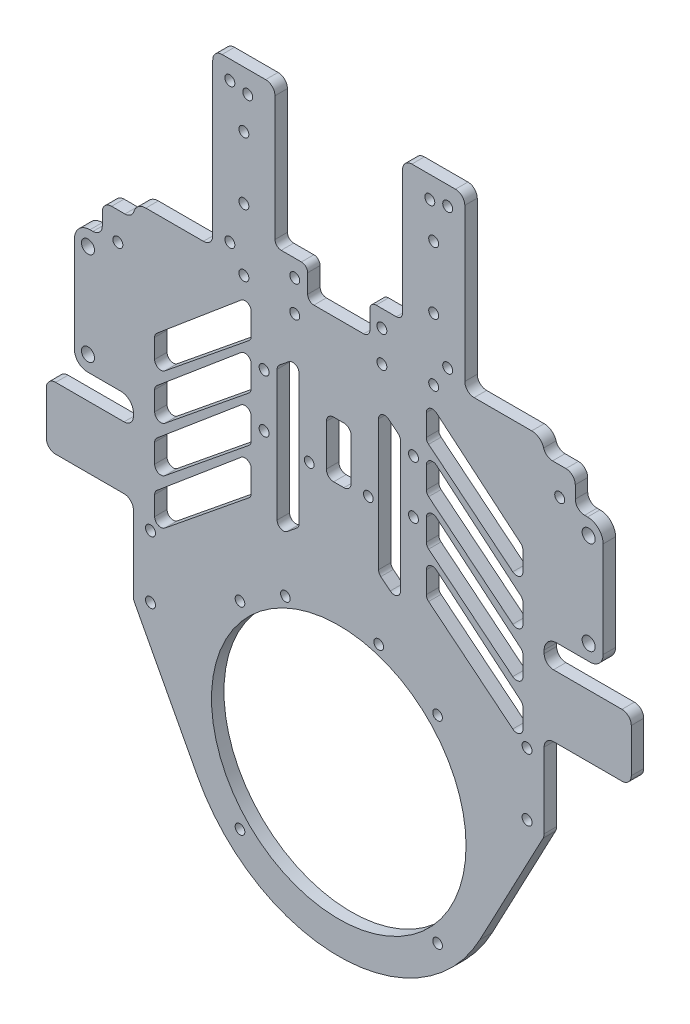
from build123d import *

# Parameters (mm, degrees)
SKETCH_1_R           = 40.9
SKETCH_1_R_2         = 1.55
SKETCH_1_R_3         = 1.6
EXTRUDE_1_DEPTH      = 4
SKETCH_2_R           = 2.1
EXTRUDE_2_DEPTH      = 4
CUT_EXTRUDE_1_DEPTH  = 4
FILLET_1_R           = 4
SKETCH_4_W           = 20
SKETCH_4_H           = 7
CUT_EXTRUDE_2_DEPTH  = 153.014810134
FILLET_2_R           = 2
SKETCH_5_W           = 20
SKETCH_5_H           = 55
EXTRUDE_3_DEPTH      = 4
FILLET_3_R           = 3
SKETCH_7_R           = 1.6
CUT_EXTRUDE_4_DEPTH  = 10
SKETCH_8_R           = 1.6
CUT_EXTRUDE_7_DEPTH  = 24
SKETCH_9_W           = 10
SKETCH_9_H           = 10
EXTRUDE_4_DEPTH      = 4
FILLET_5_R           = 3
SKETCH_10_R          = 1.6
CUT_EXTRUDE_6_DEPTH  = 4
SKETCH_11_W          = 28
SKETCH_11_H          = 20
EXTRUDE_5_DEPTH      = 4
FILLET_6_R           = 3
SKETCH_13_R          = 1.6
CUT_EXTRUDE_8_DEPTH  = 45
SKETCH_14_R          = 1.6
CUT_EXTRUDE_9_DEPTH  = 10
SKETCH_15_R          = 1.6
CUT_EXTRUDE_10_DEPTH = 10
EXTRUDE_START        = -4
SKETCH_16_R          = 1.6
EXTRUDE_6_DEPTH      = 4
SKETCH_17_W          = 20
SKETCH_17_H          = 10
CUT_EXTRUDE_11_DEPTH = 4
FILLET_7_R           = 2


with BuildPart() as part:
    # 草图1 → 凸台-拉伸1 (new body)
    with BuildSketch(Plane.XY):
        with BuildLine():
            Line((-66, 126), (66, 126))
            Line((66, 126), (66, 15.1))
            Line((66, 15.1), (45.315301009, -23.983091524))
            ThreePointArc((45.315301009, -23.983091524), (0, -51.270509892), (-45.315301009, -23.983091524))
            Line((-45.315301009, -23.983091524), (-66, 15.1))
            Line((-66, 15.1), (-66, 126))
        make_face()
        Circle(SKETCH_1_R, mode=Mode.SUBTRACT)
        with Locations((-31.749094475, 31.749094475)):
            Circle(SKETCH_1_R_2, mode=Mode.SUBTRACT)
        with Locations((-17.153096541, 40.410163067)):
            Circle(SKETCH_1_R_2, mode=Mode.SUBTRACT)
        with Locations((12.835117837, 41.981778787)):
            Circle(SKETCH_1_R_2, mode=Mode.SUBTRACT)
        with Locations((31.749094475, 31.749094475)):
            Circle(SKETCH_1_R_2, mode=Mode.SUBTRACT)
        with Locations((31.749094475, -31.749094475)):
            Circle(SKETCH_1_R_2, mode=Mode.SUBTRACT)
        with Locations((-31.749094475, -31.749094475)):
            Circle(SKETCH_1_R_2, mode=Mode.SUBTRACT)
        with Locations((-9.5, 81.5)):
            Circle(SKETCH_1_R_2, mode=Mode.SUBTRACT)
        with Locations((9.5, 81.5)):
            Circle(SKETCH_1_R_2, mode=Mode.SUBTRACT)
        with Locations((-14.15, 120.5)):
            Circle(SKETCH_1_R_3, mode=Mode.SUBTRACT)
        with Locations((13.85, 120.5)):
            Circle(SKETCH_1_R_3, mode=Mode.SUBTRACT)
    extrude(amount=EXTRUDE_1_DEPTH)

    # 草图2 → 凸台-拉伸2 (add)
    # profile 1 of 2: a face of its own
    with BuildSketch(Plane.XY.offset(4)):
        with BuildLine():
            Line((-66, 111), (-79.95, 111))
            ThreePointArc((-79.95, 111), (-83.485533906, 109.535533906), (-84.95, 106))
            Line((-84.95, 106), (-84.95, 75.2))
            ThreePointArc((-84.95, 75.2), (-83.719848481, 72.230151519), (-80.75, 71))
            Line((-80.75, 71), (-66, 71))
            Line((-66, 71), (-66, 111))
        make_face()
        with Locations((-80.6, 106)):
            Circle(SKETCH_2_R, mode=Mode.SUBTRACT)
        with Locations((-80.6, 76)):
            Circle(SKETCH_2_R, mode=Mode.SUBTRACT)
    # profile 2 of 2: a face of its own
    with BuildSketch(Plane.XY.offset(4)):
        with BuildLine():
            Line((66, 71), (66, 111))
            Line((66, 111), (79.95, 111))
            ThreePointArc((79.95, 111), (83.485533906, 109.535533906), (84.95, 106))
            Line((84.95, 106), (84.95, 75.2))
            ThreePointArc((84.95, 75.2), (83.719848481, 72.230151519), (80.75, 71))
            Line((80.75, 71), (66, 71))
        make_face()
        with Locations((80.3, 76)):
            Circle(SKETCH_2_R, mode=Mode.SUBTRACT)
        with Locations((80.3, 106)):
            Circle(SKETCH_2_R, mode=Mode.SUBTRACT)
    extrude(amount=-EXTRUDE_2_DEPTH)

    # 草图3 → 切除-拉伸1 (cut)
    with BuildSketch(Plane.XY.offset(4)):
        with BuildLine():
            Line((-4, 95.643321095), (-4, 82.356678905))
            ThreePointArc((-4, 82.356678905), (-3.30974473, 80.69025527), (-1.643321095, 80))
            Line((-1.643321095, 80), (1.643321095, 80))
            ThreePointArc((1.643321095, 80), (3.30974473, 80.69025527), (4, 82.356678905))
            Line((4, 82.356678905), (4, 95.643321095))
            ThreePointArc((4, 95.643321095), (3.30974473, 97.30974473), (1.643321095, 98))
            Line((1.643321095, 98), (-1.643321095, 98))
            ThreePointArc((-1.643321095, 98), (-3.30974473, 97.30974473), (-4, 95.643321095))
        make_face()
        with BuildLine():
            Line((-31.418930635, 115.671893756), (-58.46194948, 92.944156195))
            ThreePointArc((-58.46194948, 92.944156195), (-58.988125143, 92.257599911), (-59.175180233, 91.41307001))
            Line((-59.175180233, 91.41307001), (-59.175180233, 85.281378001))
            ThreePointArc((-59.175180233, 85.281378001), (-58.035180005, 83.475720117), (-55.914779841, 83.728512633))
            Line((-55.914779841, 83.728512633), (-28.871760995, 105.67827871))
            ThreePointArc((-28.871760995, 105.67827871), (-28.326503504, 106.371144306), (-28.132161388, 107.231144078))
            Line((-28.132161388, 107.231144078), (-28.132161388, 114.140807571))
            ThreePointArc((-28.132161388, 114.140807571), (-29.287631487, 115.953752481), (-31.418930635, 115.671893756))
        make_face()
        with BuildLine():
            Line((-28.132161388, 92.648467718), (-28.132161388, 99.558131211))
            ThreePointArc((-28.132161388, 99.558131211), (-29.287631487, 101.371076121), (-31.418930635, 101.089217396))
            Line((-31.418930635, 101.089217396), (-58.46194948, 78.361479835))
            ThreePointArc((-58.46194948, 78.361479835), (-58.988125143, 77.674923551), (-59.175180233, 76.83039365))
            Line((-59.175180233, 76.83039365), (-59.175180233, 70.698701641))
            ThreePointArc((-59.175180233, 70.698701641), (-58.035180005, 68.893043757), (-55.914779841, 69.145836273))
            Line((-55.914779841, 69.145836273), (-28.871760995, 91.09560235))
            ThreePointArc((-28.871760995, 91.09560235), (-28.326503504, 91.788467946), (-28.132161388, 92.648467718))
        make_face()
        with BuildLine():
            Line((-28.132161388, 78.065791358), (-28.132161388, 84.975454851))
            ThreePointArc((-28.132161388, 84.975454851), (-29.287631487, 86.788399761), (-31.418930635, 86.506541036))
            Line((-31.418930635, 86.506541036), (-58.46194948, 63.778803475))
            ThreePointArc((-58.46194948, 63.778803475), (-58.988125143, 63.092247191), (-59.175180233, 62.24771729))
            Line((-59.175180233, 62.24771729), (-59.175180233, 56.116025281))
            ThreePointArc((-59.175180233, 56.116025281), (-58.035180005, 54.310367397), (-55.914779841, 54.563159913))
            Line((-55.914779841, 54.563159913), (-28.871760995, 76.51292599))
            ThreePointArc((-28.871760995, 76.51292599), (-28.326503504, 77.205791586), (-28.132161388, 78.065791358))
        make_face()
        with BuildLine():
            Line((-28.132161388, 63.483114998), (-28.132161388, 70.392778491))
            ThreePointArc((-28.132161388, 70.392778491), (-29.287631487, 72.205723401), (-31.418930635, 71.923864676))
            Line((-31.418930635, 71.923864676), (-58.46194948, 49.196127115))
            ThreePointArc((-58.46194948, 49.196127115), (-58.988125143, 48.509570831), (-59.175180233, 47.66504093))
            Line((-59.175180233, 47.66504093), (-59.175180233, 41.533348921))
            ThreePointArc((-59.175180233, 41.533348921), (-58.035180005, 39.727691037), (-55.914779841, 39.980483553))
            Line((-55.914779841, 39.980483553), (-28.871760995, 61.93024963))
            ThreePointArc((-28.871760995, 61.93024963), (-28.326503504, 62.623115226), (-28.132161388, 63.483114998))
        make_face()
        with BuildLine():
            Line((-16.032131174, 106.246310649), (-19.07458677, 103.776867832))
            ThreePointArc((-19.07458677, 103.776867832), (-19.619844261, 103.084002236), (-19.814186377, 102.224002464))
            Line((-19.814186377, 102.224002464), (-19.814186377, 60.267683622))
            ThreePointArc((-19.814186377, 60.267683622), (-18.674186149, 58.462025739), (-16.553785984, 58.714818255))
            Line((-16.553785984, 58.714818255), (-13.511330388, 61.184261072))
            ThreePointArc((-13.511330388, 61.184261072), (-12.966072897, 61.877126668), (-12.771730781, 62.737126439))
            Line((-12.771730781, 62.737126439), (-12.771730781, 104.693445281))
            ThreePointArc((-12.771730781, 104.693445281), (-13.911731009, 106.499103165), (-16.032131174, 106.246310649))
        make_face()
        with BuildLine():
            Line((12.771730781, 62.737126439), (12.771730781, 104.693445281))
            ThreePointArc((12.771730781, 104.693445281), (13.911731009, 106.499103165), (16.032131174, 106.246310649))
            Line((16.032131174, 106.246310649), (19.07458677, 103.776867832))
            ThreePointArc((19.07458677, 103.776867832), (19.619844261, 103.084002236), (19.814186377, 102.224002464))
            Line((19.814186377, 102.224002464), (19.814186377, 60.267683622))
            ThreePointArc((19.814186377, 60.267683622), (18.674186149, 58.462025739), (16.553785984, 58.714818255))
            Line((16.553785984, 58.714818255), (13.511330388, 61.184261072))
            ThreePointArc((13.511330388, 61.184261072), (12.966072897, 61.877126668), (12.771730781, 62.737126439))
        make_face()
        with BuildLine():
            Line((59.175180233, 47.66504093), (59.175180233, 41.533348921))
            ThreePointArc((59.175180233, 41.533348921), (58.035180005, 39.727691037), (55.914779841, 39.980483553))
            Line((55.914779841, 39.980483553), (28.871760995, 61.93024963))
            ThreePointArc((28.871760995, 61.93024963), (28.326503504, 62.623115226), (28.132161388, 63.483114998))
            Line((28.132161388, 63.483114998), (28.132161388, 70.392778491))
            ThreePointArc((28.132161388, 70.392778491), (29.287631487, 72.205723401), (31.418930635, 71.923864676))
            Line((31.418930635, 71.923864676), (58.46194948, 49.196127115))
            ThreePointArc((58.46194948, 49.196127115), (58.988125143, 48.509570831), (59.175180233, 47.66504093))
        make_face()
        with BuildLine():
            Line((59.175180233, 62.24771729), (59.175180233, 56.116025281))
            ThreePointArc((59.175180233, 56.116025281), (58.035180005, 54.310367397), (55.914779841, 54.563159913))
            Line((55.914779841, 54.563159913), (28.871760995, 76.51292599))
            ThreePointArc((28.871760995, 76.51292599), (28.326503504, 77.205791586), (28.132161388, 78.065791358))
            Line((28.132161388, 78.065791358), (28.132161388, 84.975454851))
            ThreePointArc((28.132161388, 84.975454851), (29.287631487, 86.788399761), (31.418930635, 86.506541036))
            Line((31.418930635, 86.506541036), (58.46194948, 63.778803475))
            ThreePointArc((58.46194948, 63.778803475), (58.988125143, 63.092247191), (59.175180233, 62.24771729))
        make_face()
        with BuildLine():
            Line((59.175180233, 76.83039365), (59.175180233, 70.698701641))
            ThreePointArc((59.175180233, 70.698701641), (58.035180005, 68.893043757), (55.914779841, 69.145836273))
            Line((55.914779841, 69.145836273), (28.871760995, 91.09560235))
            ThreePointArc((28.871760995, 91.09560235), (28.326503504, 91.788467946), (28.132161388, 92.648467718))
            Line((28.132161388, 92.648467718), (28.132161388, 99.558131211))
            ThreePointArc((28.132161388, 99.558131211), (29.287631487, 101.371076121), (31.418930635, 101.089217396))
            Line((31.418930635, 101.089217396), (58.46194948, 78.361479835))
            ThreePointArc((58.46194948, 78.361479835), (58.988125143, 77.674923551), (59.175180233, 76.83039365))
        make_face()
        with BuildLine():
            Line((28.132161388, 107.231144078), (28.132161388, 114.140807571))
            ThreePointArc((28.132161388, 114.140807571), (29.287631487, 115.953752481), (31.418930635, 115.671893756))
            Line((31.418930635, 115.671893756), (58.46194948, 92.944156195))
            ThreePointArc((58.46194948, 92.944156195), (58.988125143, 92.257599911), (59.175180233, 91.41307001))
            Line((59.175180233, 91.41307001), (59.175180233, 85.281378001))
            ThreePointArc((59.175180233, 85.281378001), (58.035180005, 83.475720117), (55.914779841, 83.728512633))
            Line((55.914779841, 83.728512633), (28.871760995, 105.67827871))
            ThreePointArc((28.871760995, 105.67827871), (28.326503504, 106.371144306), (28.132161388, 107.231144078))
        make_face()
    extrude(amount=-CUT_EXTRUDE_1_DEPTH, mode=Mode.SUBTRACT)

    # 圆角1
    fillet_1_edges = [part.edges().sort_by_distance(p)[0] for p in [
        (-66, 71, 2),
        (66, 71, 2),
        (66, 126, 2),
        (-66, 126, 2),
    ]]
    fillet(fillet_1_edges, radius=FILLET_1_R)

    # 草图4 → 切除-拉伸2 (cut, through all)
    with BuildSketch(Plane.XY.offset(4)):
        with Locations((0, 122.5)):
            Rectangle(SKETCH_4_W, SKETCH_4_H)
    extrude(amount=-CUT_EXTRUDE_2_DEPTH, mode=Mode.SUBTRACT)

    # 圆角2
    fillet_2_edges = [part.edges().sort_by_distance(p)[0] for p in [
        (10, 126, 2),
        (-10, 126, 2),
        (-10, 119, 2),
        (10, 119, 2),
    ]]
    fillet(fillet_2_edges, radius=FILLET_2_R)

    # 草图5 → 凸台-拉伸3 (add)
    with BuildSketch(Plane.XY.offset(4)):
        with Locations((-30.5, 153.5)):
            Rectangle(SKETCH_5_W, SKETCH_5_H)
        with Locations((30.5, 153.5)):
            Rectangle(SKETCH_5_W, SKETCH_5_H)
    extrude(amount=-EXTRUDE_3_DEPTH)

    # 圆角3
    fillet_3_edges = [part.edges().sort_by_distance(p)[0] for p in [
        (40.5, 126, 2),
        (40.5, 181, 2),
        (-40.5, 126, 2),
        (-40.5, 181, 2),
    ]]
    fillet(fillet_3_edges, radius=FILLET_3_R)

    # 草图7 → 切除-拉伸4 (cut)
    with BuildSketch(Plane.XY.offset(4)):
        with Locations((-30.5, 163)):
            Circle(SKETCH_7_R)
        with Locations((-30.5, 143)):
            Circle(SKETCH_7_R)
        with Locations((-30.5, 123)):
            Circle(SKETCH_7_R)
        with Locations((30.5, 163)):
            Circle(SKETCH_7_R)
        with Locations((30.5, 123)):
            Circle(SKETCH_7_R)
        with Locations((30.5, 143)):
            Circle(SKETCH_7_R)
    extrude(amount=-CUT_EXTRUDE_4_DEPTH, mode=Mode.SUBTRACT)

    # 草图8 → 切除-拉伸7 (cut)
    with BuildSketch(Plane.XY.offset(4)):
        with Locations((-24, 100)):
            Circle(SKETCH_8_R)
        with Locations((24, 100)):
            Circle(SKETCH_8_R)
        with Locations((24, 83)):
            Circle(SKETCH_8_R)
        with Locations((-24, 83)):
            Circle(SKETCH_8_R)
    extrude(amount=-CUT_EXTRUDE_7_DEPTH, mode=Mode.SUBTRACT)

    # 草图9 → 凸台-拉伸4 (add)
    with BuildSketch(Plane.XY.offset(4)):
        with Locations((71, 116)):
            Rectangle(SKETCH_9_W, SKETCH_9_H)
        with Locations((-71, 116)):
            Rectangle(SKETCH_9_W, SKETCH_9_H)
    extrude(amount=-EXTRUDE_4_DEPTH)

    # 圆角5
    fillet_5_edges = [part.edges().sort_by_distance(p)[0] for p in [
        (-76, 111, 2),
        (-76, 121, 2),
        (-66, 121, 2),
        (66, 121, 2),
        (76, 121, 2),
        (76, 111, 2),
    ]]
    fillet(fillet_5_edges, radius=FILLET_5_R)

    # 草图10 → 切除-拉伸6 (cut)
    with BuildSketch(Plane.XY.offset(4)):
        with Locations((-71, 112)):
            Circle(SKETCH_10_R)
        with Locations((71, 112)):
            Circle(SKETCH_10_R)
    extrude(amount=-CUT_EXTRUDE_6_DEPTH, mode=Mode.SUBTRACT)

    # 草图11 → 凸台-拉伸5 (add)
    with BuildSketch(Plane.XY.offset(4)):
        with Locations((80, 53)):
            Rectangle(SKETCH_11_W, SKETCH_11_H)
        with Locations((-80, 53)):
            Rectangle(SKETCH_11_W, SKETCH_11_H)
    extrude(amount=-EXTRUDE_5_DEPTH)

    # 圆角6
    fillet_6_edges = [part.edges().sort_by_distance(p)[0] for p in [
        (-20.5, 181, 2),
        (20.5, 181, 2),
        (-94, 63, 2),
        (-94, 43, 2),
        (-66, 43, 2),
        (-66, 15.1, 2),
        (66, 15.1, 2),
        (66, 43, 2),
        (94, 43, 2),
        (94, 63, 2),
        (66, 63, 2),
        (-66, 63, 2),
    ]]
    fillet(fillet_6_edges, radius=FILLET_6_R)

    # 草图13 → 切除-拉伸8 (cut)
    with BuildSketch(Plane.XY.offset(4)):
        with Locations((-60.5, 37)):
            Circle(SKETCH_13_R)
        with Locations((-60.5, 17)):
            Circle(SKETCH_13_R)
        with Locations((60.5, 17)):
            Circle(SKETCH_13_R)
        with Locations((60.5, 37)):
            Circle(SKETCH_13_R)
    extrude(amount=-CUT_EXTRUDE_8_DEPTH, mode=Mode.SUBTRACT)

    # 草图14 → 切除-拉伸9 (cut)
    with BuildSketch(Plane.XY.offset(4)):
        with Locations((-29.25, 174)):
            Circle(SKETCH_14_R)
        with Locations((29.25, 174)):
            Circle(SKETCH_14_R)
    extrude(amount=-CUT_EXTRUDE_9_DEPTH, mode=Mode.SUBTRACT)

    # 草图15 → 切除-拉伸10 (cut)
    with BuildSketch(Plane.XY.offset(4)):
        with Locations((-35, 175)):
            Circle(SKETCH_15_R)
        with Locations((35, 175)):
            Circle(SKETCH_15_R)
        with Locations((-35, 130)):
            Circle(SKETCH_15_R)
        with Locations((35, 130)):
            Circle(SKETCH_15_R)
    extrude(amount=-CUT_EXTRUDE_10_DEPTH, mode=Mode.SUBTRACT)

    # 草图16 → 凸台-拉伸6 (add)
    with BuildSketch(Plane.XY.offset(4).offset(EXTRUDE_START)):
        with BuildLine():
            Line((-20.5, 136), (20.5, 136))
            Line((20.5, 136), (20.5, 126))
            Line((20.5, 126), (12, 126))
            ThreePointArc((12, 126), (10.585786438, 125.414213562), (10, 124))
            Line((10, 124), (10, 121))
            ThreePointArc((10, 121), (9.414213562, 119.585786438), (8, 119))
            Line((8, 119), (-8, 119))
            ThreePointArc((-8, 119), (-9.414213562, 119.585786438), (-10, 121))
            Line((-10, 121), (-10, 124))
            ThreePointArc((-10, 124), (-10.585786438, 125.414213562), (-12, 126))
            Line((-12, 126), (-20.5, 126))
            Line((-20.5, 126), (-20.5, 136))
        make_face()
        with Locations((-14.15, 130.5)):
            Circle(SKETCH_16_R, mode=Mode.SUBTRACT)
        with Locations((13.85, 130.5)):
            Circle(SKETCH_16_R, mode=Mode.SUBTRACT)
    extrude(amount=EXTRUDE_6_DEPTH)

    # 草图17 → 切除-拉伸11 (cut)
    with BuildSketch(Plane.XY.offset(4)):
        with Locations((0, 131)):
            Rectangle(SKETCH_17_W, SKETCH_17_H)
    extrude(amount=-CUT_EXTRUDE_11_DEPTH, mode=Mode.SUBTRACT)

    # 圆角7
    fillet_7_edges = [part.edges().sort_by_distance(p)[0] for p in [
        (10, 126, 2),
        (-10, 126, 2),
        (-10, 136, 2),
        (20.5, 136, 2),
        (10, 136, 2),
        (-20.5, 136, 2),
    ]]
    fillet(fillet_7_edges, radius=FILLET_7_R)


solid = part.part
